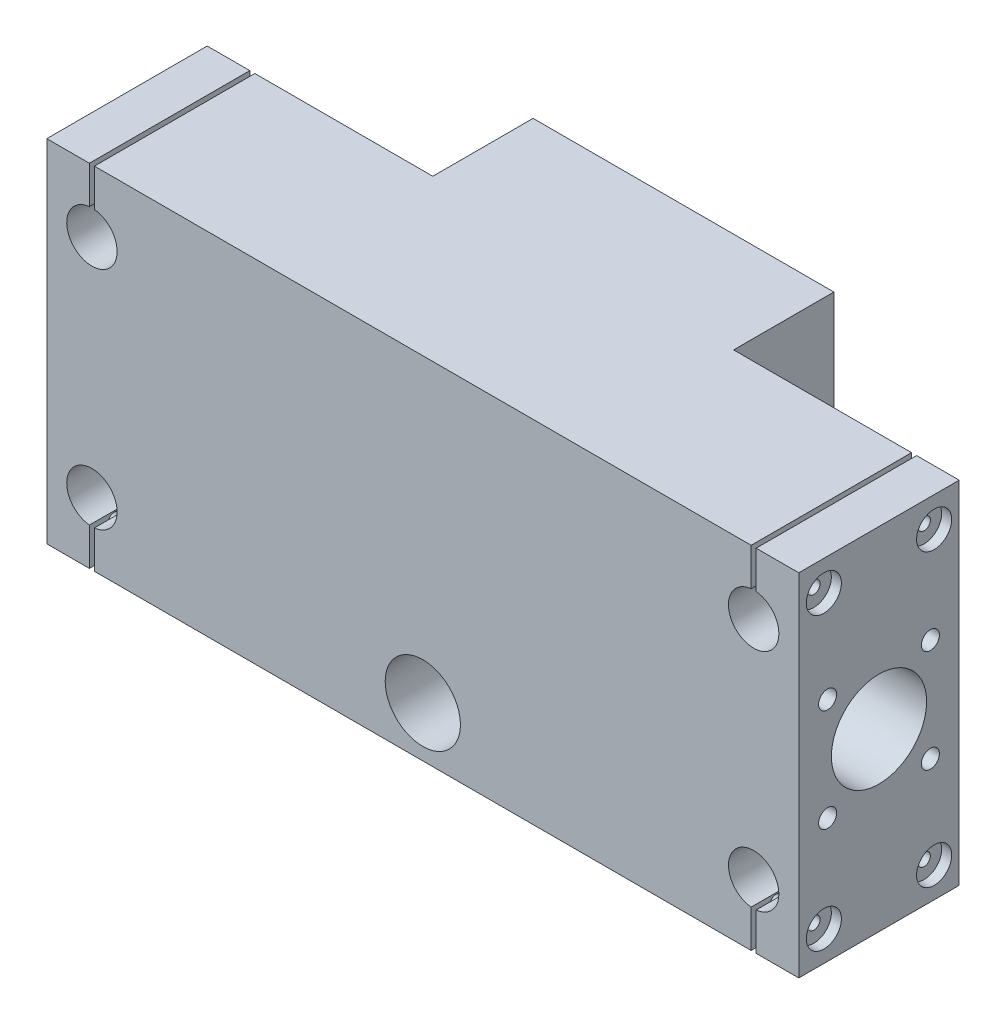
from build123d import *

# Parameters (mm, degrees)
SKETCH1_W                      = 150
SKETCH1_H                      = 70
BOSS_EXTRUDE1_DEPTH            = 32
SKETCH2_R                      = 9.5
LINEAR_BEARING_CUT_1_DEPTH     = 55
Y_AXIS_SHAFTS_CUT_DEPTH        = 169.594187326
LINEAR_BEARING_CUT_2_START     = -55
SKETCH7_R                      = 9.5
LINEAR_BEARING_CUT_2_DEPTH     = 55
SKETCH6_R                      = 6
BETWEEN_BEARINGS_DEPTH         = 123.266103234
SKETCH8_R                      = 3.5
SHAFT_HOLDER_SCREW_CUT_DEPTH   = 4
SKETCH9_R                      = 1.25
SHAFT_HOLDER_SCREW_CUT2_DEPTH  = 20
SHAFT_HOLDER_SCREW_CUT_3_START = -2
SKETCH10_R                     = 3.5
SHAFT_HOLDER_SCREW_CUT_3_DEPTH = 2
SHAFT_HOLDER_SCREW_CUT_4_START = -20
SKETCH11_R                     = 1.25
SHAFT_HOLDER_SCREW_CUT_4_DEPTH = 20
SKETCH12_R                     = 1.8
LINEAR_BEARING_SREW1_DEPTH     = 14
SKETCH13_R                     = 1.85
LINEAR_BEARING_SCREW2_DEPTH    = 14
SKETCH14_R                     = 7.5
CUT_EXTRUDE1_DEPTH             = 169.594187326
SKETCH15_W                     = 60
SKETCH15_H                     = 38
BOSS_EXTRUDE2_DEPTH            = 20


with BuildPart() as part:
    # Sketch1 → Boss-Extrude1 (new body)
    with BuildSketch(Plane.XY):
        with Locations((-75, -35)):
            Rectangle(SKETCH1_W, SKETCH1_H)
    extrude(amount=BOSS_EXTRUDE1_DEPTH)

    # Sketch2 → Linear_bearing-cut-1 (cut)
    with BuildSketch(Plane.ZY.offset(150)):
        with Locations((16, -35)):
            Circle(SKETCH2_R)
    extrude(amount=-LINEAR_BEARING_CUT_1_DEPTH, mode=Mode.SUBTRACT)

    # Sketch5 → Y-axis-shafts-cut (cut, through all)
    with BuildSketch(Plane.XY.offset(32)):
        with BuildLine():
            Line((-141.5, 0), (-141.5, -7.5))
            ThreePointArc((-141.5, -7.5), (-141, -17.524937811), (-140.5, -7.5))
            Line((-140.5, -7.5), (-140.5, 0))
            Line((-140.5, 0), (-141.5, 0))
        make_face()
        with BuildLine():
            Line((-8.5, 0), (-8.5, -7.5))
            ThreePointArc((-8.5, -7.5), (-9, -17.524937811), (-9.5, -7.5))
            Line((-9.5, -7.5), (-9.5, 0))
            Line((-9.5, 0), (-8.5, 0))
        make_face()
        with BuildLine():
            Line((-141.5, -70), (-141.5, -62.5))
            ThreePointArc((-141.5, -62.5), (-141, -52.475062189), (-140.5, -62.5))
            Line((-140.5, -62.5), (-140.5, -70))
            Line((-140.5, -70), (-141.5, -70))
        make_face()
        with BuildLine():
            Line((-9.5, -70), (-9.5, -62.5))
            ThreePointArc((-9.5, -62.5), (-9, -52.475062189), (-8.5, -62.5))
            Line((-8.5, -62.5), (-8.5, -70))
            Line((-8.5, -70), (-9.5, -70))
        make_face()
    extrude(amount=-Y_AXIS_SHAFTS_CUT_DEPTH, mode=Mode.SUBTRACT)

    # Sketch7 → Linear-bearing-cut-2 (cut)
    with BuildSketch(Plane(origin=(0, 0, 0), x_dir=(0, 0, -1), z_dir=(1, 0, 0)).offset(LINEAR_BEARING_CUT_2_START)):
        with Locations((-16, -35)):
            Circle(SKETCH7_R)
    extrude(amount=LINEAR_BEARING_CUT_2_DEPTH, mode=Mode.SUBTRACT)

    # Sketch6 → between-bearings (cut, through all)
    with BuildSketch(Plane.ZY.offset(95)):
        with Locations((16, -35)):
            Circle(SKETCH6_R)
    extrude(amount=-BETWEEN_BEARINGS_DEPTH, mode=Mode.SUBTRACT)

    # Sketch8 → shaft-holder-screw-cut (cut)
    with BuildSketch(Plane.ZY.offset(150)):
        with Locations((5, -6)):
            Circle(SKETCH8_R)
        with Locations((27, -6)):
            Circle(SKETCH8_R)
        with Locations((27, -64)):
            Circle(SKETCH8_R)
        with Locations((5, -64)):
            Circle(SKETCH8_R)
    extrude(amount=-SHAFT_HOLDER_SCREW_CUT_DEPTH, mode=Mode.SUBTRACT)

    # Sketch9 → shaft-holder-screw-cut2 (cut)
    with BuildSketch(Plane.ZY.offset(146)):
        with Locations((5, -6)):
            Circle(SKETCH9_R)
        with Locations((27, -6)):
            Circle(SKETCH9_R)
        with Locations((5, -64)):
            Circle(SKETCH9_R)
        with Locations((27, -64)):
            Circle(SKETCH9_R)
    extrude(amount=-SHAFT_HOLDER_SCREW_CUT2_DEPTH, mode=Mode.SUBTRACT)

    # Sketch10 → shaft-holder-screw-cut-3 (cut)
    with BuildSketch(Plane(origin=(0, 0, 0), x_dir=(0, 0, -1), z_dir=(1, 0, 0)).offset(SHAFT_HOLDER_SCREW_CUT_3_START)):
        with Locations((-27, -6)):
            Circle(SKETCH10_R)
        with Locations((-5, -6)):
            Circle(SKETCH10_R)
        with Locations((-5, -64)):
            Circle(SKETCH10_R)
        with Locations((-27, -64)):
            Circle(SKETCH10_R)
    extrude(amount=SHAFT_HOLDER_SCREW_CUT_3_DEPTH, mode=Mode.SUBTRACT)

    # Sketch11 → shaft-holder-screw-cut-4 (cut)
    with BuildSketch(Plane(origin=(-2, 0, 0), x_dir=(0, 0, -1), z_dir=(1, 0, 0)).offset(SHAFT_HOLDER_SCREW_CUT_4_START)):
        with Locations((-27, -6)):
            Circle(SKETCH11_R)
        with Locations((-5, -6)):
            Circle(SKETCH11_R)
        with Locations((-5, -64)):
            Circle(SKETCH11_R)
        with Locations((-27, -64)):
            Circle(SKETCH11_R)
    extrude(amount=SHAFT_HOLDER_SCREW_CUT_4_DEPTH, mode=Mode.SUBTRACT)

    # Sketch12 → Linear-bearing-srew1 (cut)
    with BuildSketch(Plane(origin=(0, 0, 0), x_dir=(0, 0, -1), z_dir=(1, 0, 0))):
        with Locations((-5.75, -24.75)):
            Circle(SKETCH12_R)
        with Locations((-26.25, -24.75)):
            Circle(SKETCH12_R)
        with Locations((-5.75, -45.25)):
            Circle(SKETCH12_R)
        with Locations((-26.25, -45.25)):
            Circle(SKETCH12_R)
    extrude(amount=-LINEAR_BEARING_SREW1_DEPTH, mode=Mode.SUBTRACT)

    # Sketch13 → Linear-bearing-screw2 (cut)
    with BuildSketch(Plane.ZY.offset(150)):
        with Locations((27.5, -24.75)):
            Circle(SKETCH13_R)
        with Locations((4.5, -24.75)):
            Circle(SKETCH13_R)
        with Locations((27.5, -45.25)):
            Circle(SKETCH13_R)
        with Locations((4.5, -45.25)):
            Circle(SKETCH13_R)
    extrude(amount=-LINEAR_BEARING_SCREW2_DEPTH, mode=Mode.SUBTRACT)

    # Sketch14 → Cut-Extrude1 (cut, through all)
    with BuildSketch(Plane(origin=(0, 0, 0), x_dir=(-1, 0, 0), z_dir=(0, 0, -1))):
        with Locations((75, -60)):
            Circle(SKETCH14_R)
    extrude(amount=-CUT_EXTRUDE1_DEPTH, mode=Mode.SUBTRACT)

    # Sketch15 → Boss-Extrude2 (add)
    with BuildSketch(Plane(origin=(0, 0, 0), x_dir=(-1, 0, 0), z_dir=(0, 0, -1))):
        with Locations((75, -19)):
            Rectangle(SKETCH15_W, SKETCH15_H)
    extrude(amount=BOSS_EXTRUDE2_DEPTH)


solid = part.part
